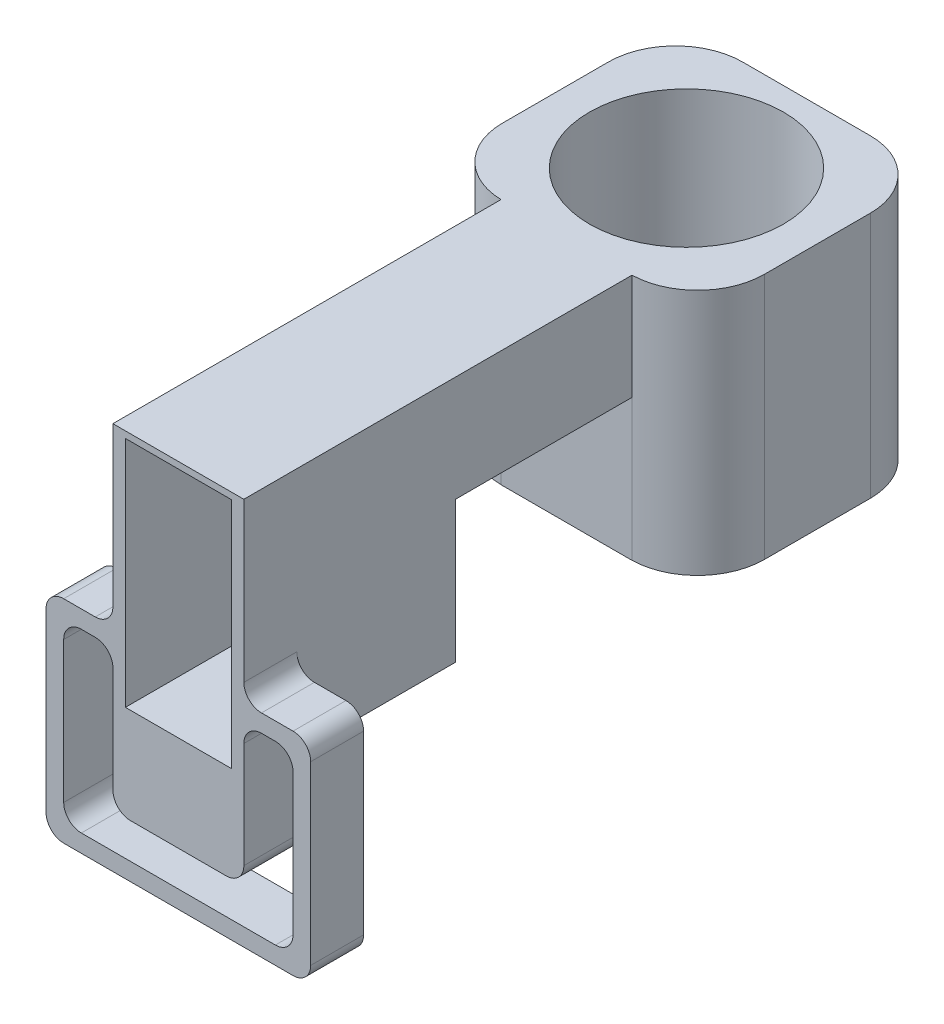
from build123d import *

# Parameters (mm, degrees)
SKETCH1_W           = 74.22368895
SKETCH1_H           = 68
SKETCH1_W_2         = 37.111844475
SKETCH1_H_2         = 52
SKETCH1_H_3         = 58
BOSS_EXTRUDE1_DEPTH = 70
SKETCH2_R           = 27.5
CUT_EXTRUDE1_DEPTH  = 70
FILLET1_R           = 19
SKETCH3_W           = 33.111844475
SKETCH3_H           = 64.288874977
CUT_EXTRUDE2_DEPTH  = 58
SKETCH5_W           = 50
SKETCH5_H           = 40
CUT_EXTRUDE3_DEPTH  = 58
SKETCH7_W           = 29.516350972
SKETCH7_H           = 18.630296647
CUT_EXTRUDE5_DEPTH  = 58
SKETCH8_W           = 33.111844475
SKETCH8_H           = 2
CUT_EXTRUDE6_DEPTH  = 58
SKETCH9_W           = 1.55
SKETCH9_H           = 66.288874977
BOSS_EXTRUDE2_DEPTH = 58
SKETCH10_W          = 30.011844475
SKETCH10_H          = 0.145
BOSS_EXTRUDE3_DEPTH = 58
SKETCH11_W          = 37.111844475
SKETCH11_H          = 24.941562027
BOSS_EXTRUDE5_DEPTH = 15
FILLET3_R           = 5
FILLET4_R           = 5
FILLET5_R           = 5


with BuildPart() as part:
    # Sketch1 → Boss-Extrude1 (new body)
    with BuildSketch(Plane(origin=(0, 0, 0), x_dir=(1, 0, 0), z_dir=(0, 1, 0))):
        with Locations((-37.111844475, -34)):
            Rectangle(SKETCH1_W, SKETCH1_H)
        with Locations((-37.111844475, -94)):
            Rectangle(SKETCH1_W_2, SKETCH1_H_2)
        with Locations((-37.111844475, -149)):
            Rectangle(SKETCH1_W_2, SKETCH1_H_3)
    extrude(amount=-BOSS_EXTRUDE1_DEPTH)

    # Sketch2 → Cut-Extrude1 (cut)
    with BuildSketch(Plane(origin=(0, 0, 0), x_dir=(1, 0, 0), z_dir=(0, 1, 0))):
        with Locations(Location((-37.111844475, -34, 0), (0, 0, 270))):
            Circle(SKETCH2_R)
    extrude(amount=-CUT_EXTRUDE1_DEPTH, mode=Mode.SUBTRACT)

    # Fillet1
    # the kernel refuses this fillet: 19 mm, written as the material it takes off along each edge
    with BuildSketch(Plane(origin=(0, 47.487024211, 68), x_dir=(0, 0, -1), z_dir=(0, -1, 0))) as fillet1_piece_1:
        with BuildLine():
            CenterArc((18.994809684, -19), FILLET1_R, 90, 88.660731648)
            Line((0, -18.555922237), (-0.379896194, -18.547040682))
            ThreePointArc((-0.379896194, -18.547040682), (-0.38, -9.277961119), (-0.38, 0))
            Line((-0.38, 0), (0, 0.38))
            Line((0, 0.38), (18.994809684, 0.38))
            Line((18.994809684, 0.38), (18.994809684, 0))
        make_face()
    extrude(amount=164.974048421, mode=Mode.SUBTRACT)
    with BuildSketch(Plane(origin=(0, 47.5, 0), x_dir=(-1, 0, 0), z_dir=(0, -1, 0))) as fillet1_piece_2:
        with BuildLine():
            CenterArc((FILLET1_R, -FILLET1_R), FILLET1_R, 90, 90)
            Line((0, -FILLET1_R), (-FILLET1_R * 0.02, -FILLET1_R))
            Line((-FILLET1_R * 0.02, -FILLET1_R), (-FILLET1_R * 0.02, FILLET1_R * 0.02))
            Line((-FILLET1_R * 0.02, FILLET1_R * 0.02), (FILLET1_R, FILLET1_R * 0.02))
            Line((FILLET1_R, FILLET1_R * 0.02), (FILLET1_R, 0))
        make_face()
    extrude(amount=165, mode=Mode.SUBTRACT)
    with BuildSketch(Plane(origin=(-74.22368895, 47.487024211, 68), x_dir=(0, 0, -1), z_dir=(0, -1, 0))) as fillet1_piece_3:
        with BuildLine():
            CenterArc((18.994809684, 19), FILLET1_R, 181.339268352, 88.660731648)
            Line((0, 18.555922237), (-0.379896194, 18.547040682))
            ThreePointArc((-0.379896194, 18.547040682), (-0.38, 9.277961119), (-0.38, 0))
            Line((-0.38, 0), (0, -0.38))
            Line((0, -0.38), (18.994809684, -0.38))
            Line((18.994809684, -0.38), (18.994809684, 0))
        make_face()
    extrude(amount=164.974048421, mode=Mode.SUBTRACT)
    with BuildSketch(Plane(origin=(-74.22368895, 47.5, 0), x_dir=(1, 0, 0), z_dir=(0, -1, 0))) as fillet1_piece_4:
        with BuildLine():
            CenterArc((FILLET1_R, FILLET1_R), FILLET1_R, 180, 90)
            Line((0, FILLET1_R), (-FILLET1_R * 0.02, FILLET1_R))
            Line((-FILLET1_R * 0.02, FILLET1_R), (-FILLET1_R * 0.02, -FILLET1_R * 0.02))
            Line((-FILLET1_R * 0.02, -FILLET1_R * 0.02), (FILLET1_R, -FILLET1_R * 0.02))
            Line((FILLET1_R, -FILLET1_R * 0.02), (FILLET1_R, 0))
        make_face()
    extrude(amount=165, mode=Mode.SUBTRACT)

    # Sketch3 → Cut-Extrude2 (cut)
    with BuildSketch(Plane.XY.offset(178)):
        with Locations((-37.111844475, -35.855562511)):
            Rectangle(SKETCH3_W, SKETCH3_H)
    extrude(amount=-CUT_EXTRUDE2_DEPTH, mode=Mode.SUBTRACT)

    # Sketch5 → Cut-Extrude3 (cut)
    with BuildSketch(Plane.ZY.offset(55.667766712)):
        with Locations((93, -50)):
            Rectangle(SKETCH5_W, SKETCH5_H)
    extrude(amount=-CUT_EXTRUDE3_DEPTH, mode=Mode.SUBTRACT)

    # Sketch7 → Cut-Extrude5 (cut)
    with BuildSketch(Plane(origin=(0, 0, 118), x_dir=(-1, 0, 0), z_dir=(0, 0, -1))):
        with Locations((37.314097723, -50.684851677)):
            Rectangle(SKETCH7_W, SKETCH7_H)
    extrude(amount=-CUT_EXTRUDE5_DEPTH, mode=Mode.SUBTRACT)

    # Sketch8 → Cut-Extrude6 (cut)
    with BuildSketch(Plane.XY.offset(178)):
        with Locations((-37.111844475, -2.711125023)):
            Rectangle(SKETCH8_W, SKETCH8_H)
    extrude(amount=-CUT_EXTRUDE6_DEPTH, mode=Mode.SUBTRACT)

    # Sketch9 → Boss-Extrude2 (add)
    with BuildSketch(Plane.XY.offset(178)):
        with Locations((-52.892766712, -34.855562511)):
            Rectangle(SKETCH9_W, SKETCH9_H)
        with Locations((-21.330922237, -34.855562511)):
            Rectangle(SKETCH9_W, SKETCH9_H)
    extrude(amount=-BOSS_EXTRUDE2_DEPTH)

    # Sketch10 → Boss-Extrude3 (add)
    with BuildSketch(Plane.XY.offset(178)):
        with Locations((-37.111844475, -67.9275)):
            Rectangle(SKETCH10_W, SKETCH10_H)
        with Locations((-37.111844475, -1.783625023)):
            Rectangle(SKETCH10_W, SKETCH10_H)
    extrude(amount=-BOSS_EXTRUDE3_DEPTH)

    # Sketch11 → Boss-Extrude5 (add)
    with BuildSketch(Plane.XY.offset(178)):
        Polygon((-74.611844475, -49.941562027), (-74.611844475, -109.941562027), (0.388155525, -109.941562027), (0.388155525, -49.941562027), (-18.555922237, -49.941562027), (-18.555922237, -54.941562027), (-4.611844475, -54.941562027), (-4.611844475, -104.941562027), (-69.611844475, -104.941562027), (-69.611844475, -54.941562027), (-55.667766712, -54.941562027), (-55.667766712, -49.941562027), align=None)
        with Locations((-37.111844475, -82.470781014)):
            Rectangle(SKETCH11_W, SKETCH11_H)
    extrude(amount=-BOSS_EXTRUDE5_DEPTH)

    # Fillet3
    fillet3_edges = [part.edges().sort_by_distance(p)[0] for p in [
        (-4.611844475, -104.941562027, 170.5),
        (-4.611844475, -54.941562027, 170.5),
        (0.388155525, -49.941562027, 170.5),
        (0.388155525, -109.941562027, 170.5),
        (-74.611844475, -109.941562027, 170.5),
        (-74.611844475, -49.941562027, 170.5),
        (-69.611844475, -54.941562027, 170.5),
        (-69.611844475, -104.941562027, 170.5),
        (-18.555922237, -94.941562027, 170.5),
        (-55.667766712, -94.941562027, 170.5),
    ]]
    fillet(fillet3_edges, radius=FILLET3_R)

    # Fillet4
    fillet4_edges = [part.edges().sort_by_distance(p)[0] for p in [
        (-18.555922237, -54.941562027, 170.5),
        (-55.667766712, -54.941562027, 170.5),
    ]]
    fillet(fillet4_edges, radius=FILLET4_R)

    # Fillet5
    fillet5_edges = [part.edges().sort_by_distance(p)[0] for p in [
        (-18.555922237, -49.941562027, 170.5),
        (-55.667766712, -49.941562027, 170.5),
    ]]
    fillet(fillet5_edges, radius=FILLET5_R)


solid = part.part
